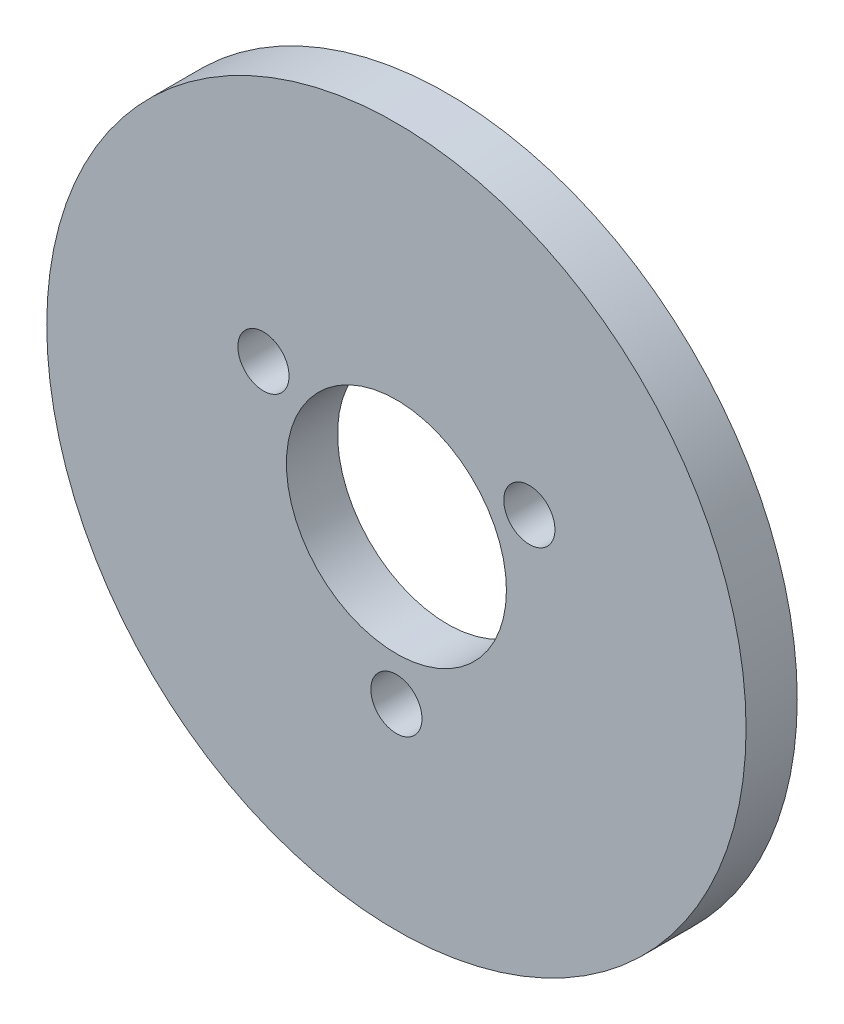
from build123d import *

# Parameters (mm, degrees)
SKETCH1_R           = 20.5
SKETCH1_R_2         = 6.45
BOSS_EXTRUDE1_DEPTH = 3
SKETCH2_R           = 1.5
CUT_EXTRUDE1_DEPTH  = 30.146183284


with BuildPart() as part:
    # Sketch1 → Boss-Extrude1 (new body)
    with BuildSketch(Plane.XY):
        Circle(SKETCH1_R)
        Circle(SKETCH1_R_2, mode=Mode.SUBTRACT)
    extrude(amount=BOSS_EXTRUDE1_DEPTH)

    # Sketch2 → Cut-Extrude1 (cut, through all)
    with BuildSketch(Plane(origin=(0, 0, 0), x_dir=(-1, 0, 0), z_dir=(0, 0, -1))):
        with Locations((7.794228634, 4.5)):
            Circle(SKETCH2_R)
        with Locations((-7.794228634, 4.5)):
            Circle(SKETCH2_R)
        with Locations((0, -9)):
            Circle(SKETCH2_R)
    extrude(amount=-CUT_EXTRUDE1_DEPTH, mode=Mode.SUBTRACT)


solid = part.part
